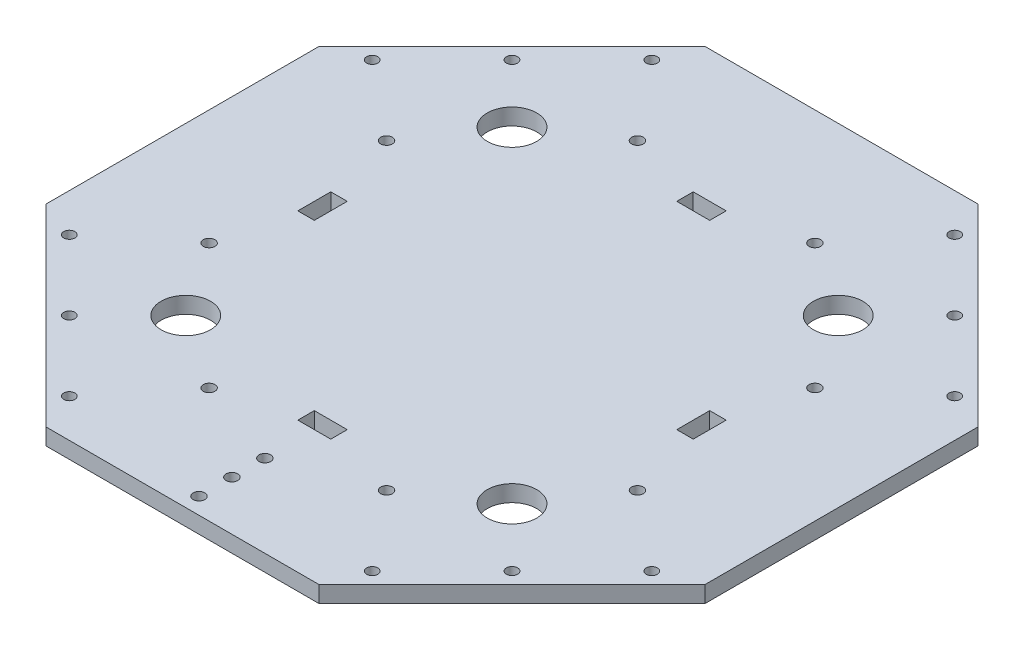
from build123d import *

# Parameters (mm, degrees)
BASE_DEPTH                   = 6.35
SUPPORT_CUTOUTS_REACH        = 181.717
SKETCH4_W                    = 12.7
SKETCH4_H                    = 6.35
SUPPORT_CUTOUT_PATTERN_COUNT = 4
F_8_CLEARANCE_HOLE1_D        = 4.4958
CABLE_HOLES_REACH            = 181.717
SKETCH14_R                   = 9.525
F_8_CLEARANCE_HOLE2_D        = 4.4958
PLATE_MOUNTING_HOLES_D       = 4.3053
CIRPATTERN1_COUNT            = 4


with BuildPart() as part:
    # Base sketch → Base (new body)
    with BuildSketch(Plane(origin=(0, 0, 0), x_dir=(1, 0, 0), z_dir=(0, 1, 0))):
        Polygon((-127, 52.605122421), (-127, -52.605122421), (-52.605122421, -127), (52.605122421, -127), (127, -52.605122421), (127, 52.605122421), (52.605122421, 127), (-52.605122421, 127), align=None)
    extrude(amount=BASE_DEPTH)

    # Sketch4 → Support cutouts (cut, up to next)
    with BuildSketch(Plane(origin=(0, 6.35, 0), x_dir=(1, 0, 0), z_dir=(0, 1, 0)), mode=Mode.PRIVATE) as support_cutouts_sk1:
        with Locations((0, 73.025)):
            Rectangle(SKETCH4_W, SKETCH4_H)
    support_cutouts_tool1 = extrude(support_cutouts_sk1.sketch, amount=-SUPPORT_CUTOUTS_REACH, mode=Mode.PRIVATE) & part.part
    support_cutouts = support_cutouts_tool1.solids().sort_by_distance((0, 6.35, -73.025))[0]
    add(support_cutouts, mode=Mode.SUBTRACT)

    # Support cutout pattern: Support cutouts ×4 about axis
    support_cutout_pattern_axis = Axis((0, -0.29972, 0), (0, 1, 0))
    for i in range(1, SUPPORT_CUTOUT_PATTERN_COUNT):
        add(support_cutouts.rotate(support_cutout_pattern_axis, i * 360 / SUPPORT_CUTOUT_PATTERN_COUNT), mode=Mode.SUBTRACT)

    # #8 Clearance Hole1 (through all)
    with Locations(Plane(origin=(0, 6.35, 0), x_dir=(1, 0, 0), z_dir=(0, 1, 0))):
        with Locations((-82.55, 34.193329574), (-34.193329574, 82.55), (34.193329574, 82.55), (82.55, 34.193329574), (82.55, -34.193329574), (34.193329574, -82.55), (-34.193329574, -82.55), (-82.55, -34.193329574)):
            Hole(F_8_CLEARANCE_HOLE1_D / 2)

    # Sketch14 → Cable holes (cut, up to next)
    with BuildSketch(Plane(origin=(0, 6.35, 0), x_dir=(1, 0, 0), z_dir=(0, 1, 0)), mode=Mode.PRIVATE) as cable_holes_sk1:
        with Locations((-62.861792847, 62.861792847)):
            Circle(SKETCH14_R)
    cable_holes_tool1 = extrude(cable_holes_sk1.sketch, amount=-CABLE_HOLES_REACH, mode=Mode.PRIVATE) & part.part
    # Sketch14 → Cable holes (cut, up to next)
    with BuildSketch(Plane(origin=(0, 6.35, 0), x_dir=(1, 0, 0), z_dir=(0, 1, 0)), mode=Mode.PRIVATE) as cable_holes_sk2:
        with Locations((62.861792847, 62.861792847)):
            Circle(SKETCH14_R)
    cable_holes_tool2 = extrude(cable_holes_sk2.sketch, amount=-CABLE_HOLES_REACH, mode=Mode.PRIVATE) & part.part
    # Sketch14 → Cable holes (cut, up to next)
    with BuildSketch(Plane(origin=(0, 6.35, 0), x_dir=(1, 0, 0), z_dir=(0, 1, 0)), mode=Mode.PRIVATE) as cable_holes_sk3:
        with Locations((62.861792847, -62.861792847)):
            Circle(SKETCH14_R)
    cable_holes_tool3 = extrude(cable_holes_sk3.sketch, amount=-CABLE_HOLES_REACH, mode=Mode.PRIVATE) & part.part
    # Sketch14 → Cable holes (cut, up to next)
    with BuildSketch(Plane(origin=(0, 6.35, 0), x_dir=(1, 0, 0), z_dir=(0, 1, 0)), mode=Mode.PRIVATE) as cable_holes_sk4:
        with Locations((-62.861792847, -62.861792847)):
            Circle(SKETCH14_R)
    cable_holes_tool4 = extrude(cable_holes_sk4.sketch, amount=-CABLE_HOLES_REACH, mode=Mode.PRIVATE) & part.part
    add(cable_holes_tool1.solids().sort_by_distance((-62.861793, 6.35, -62.861793))[0], mode=Mode.SUBTRACT)
    add(cable_holes_tool2.solids().sort_by_distance((62.861793, 6.35, -62.861793))[0], mode=Mode.SUBTRACT)
    add(cable_holes_tool3.solids().sort_by_distance((62.861793, 6.35, 62.861793))[0], mode=Mode.SUBTRACT)
    add(cable_holes_tool4.solids().sort_by_distance((-62.861793, 6.35, 62.861793))[0], mode=Mode.SUBTRACT)

    # #8 Clearance Hole2 (through all)
    with Locations(Plane(origin=(0, 6.35, 0), x_dir=(1, 0, 0), z_dir=(0, 1, 0))):
        with Locations((0, -120.65), (0, -107.95), (0, -95.25)):
            Hole(F_8_CLEARANCE_HOLE2_D / 2)

    # plate mounting holes (through all)
    with Locations(Plane(origin=(0, 6.35, 0), x_dir=(1, 0, 0), z_dir=(0, 1, 0))):
        with Locations((112.253201513, 58.371664787), (85.31243315, 85.31243315), (58.371664787, 112.253201513)):
            plate_mounting_holes = Hole(PLATE_MOUNTING_HOLES_D / 2)

    # CirPattern1: plate mounting holes ×4 about axis
    cirpattern1_axis = Axis((0, -0.29972, 0), (0, 1, 0))
    for i in range(1, CIRPATTERN1_COUNT):
        add(plate_mounting_holes.rotate(cirpattern1_axis, i * 360 / CIRPATTERN1_COUNT), mode=Mode.SUBTRACT)


solid = part.part
